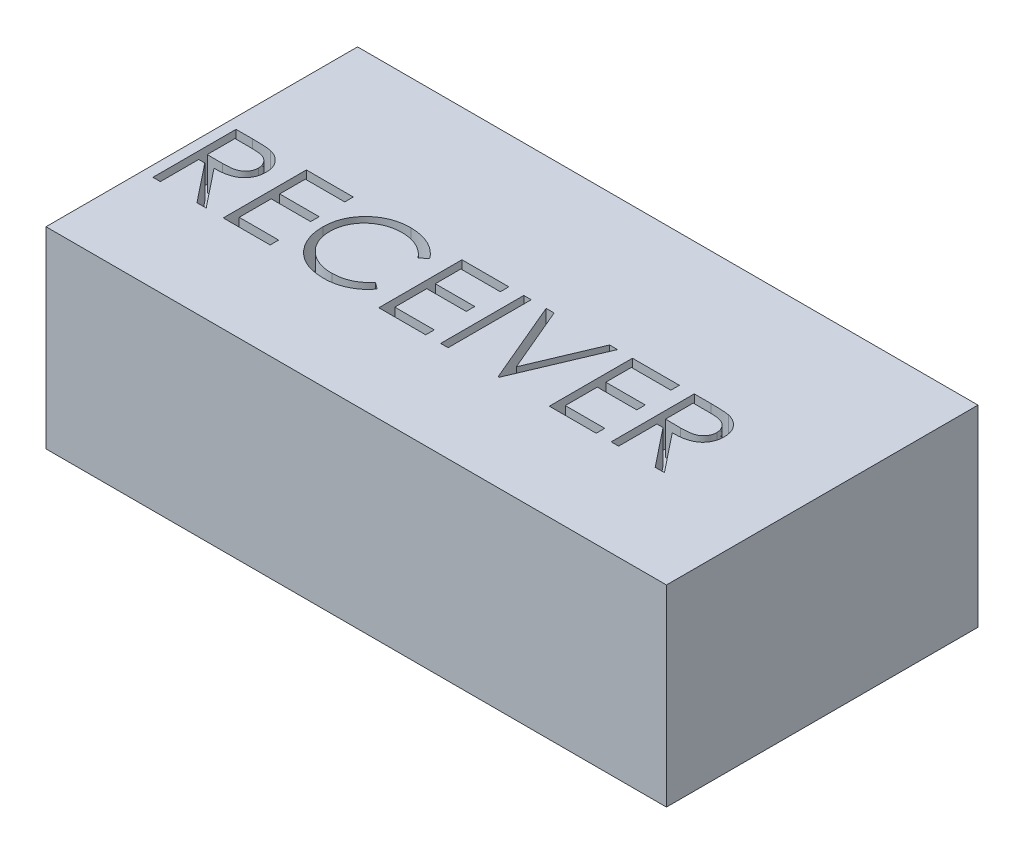
from build123d import *

# Parameters (mm, degrees)
SKETCH1_W           = 47.4
SKETCH1_H           = 23.8
BOSS_EXTRUDE1_DEPTH = 14.7
SKETCH2_W           = 0.569871795
SKETCH2_H           = 6.35
CUT_EXTRUDE1_DEPTH  = 2.54


with BuildPart() as part:
    # Sketch1 → Boss-Extrude1 (new body)
    with BuildSketch(Plane(origin=(0, 0, 0), x_dir=(1, 0, 0), z_dir=(0, 1, 0))):
        Rectangle(SKETCH1_W, SKETCH1_H)
    extrude(amount=BOSS_EXTRUDE1_DEPTH)

    # Sketch2 → Cut-Extrude1 (cut)
    # profile 1 of 8: a face of its own
    with BuildSketch(Plane(origin=(0, 14.7, 0), x_dir=(1, 0, 0), z_dir=(0, 1, 0))):
        with BuildLine():
            Line((-22.885897436, 1.803083105), (-21.615134215, 1.803083105))
            add(Edge.make_bspline(
                [(-21.615134215, 1.803083105), (-21.530332453, 1.802800827), (-21.367503677, 1.802258824), (-21.134235029, 1.799236654), (-20.922277296, 1.790574608), (-20.731741302, 1.783120464), (-20.562630542, 1.769527942), (-20.414426457, 1.756536482), (-20.287811635, 1.739529983), (-20.21116559, 1.723735859), (-20.17646234, 1.716584707)],
                knots=[0, 0, 0, 0, 1.410062039, 2.707475311, 3.878576406, 4.937260626, 5.877586885, 6.699081471, 7.410979367, 8, 8, 8, 8], degree=3))
            add(Edge.make_bspline(
                [(-20.17646234, 1.716584707), (-20.130004607, 1.705106147), (-20.038080212, 1.682393896), (-19.90572795, 1.63438862), (-19.779609105, 1.578835873), (-19.660247566, 1.513587409), (-19.548241202, 1.43815888), (-19.442435124, 1.353852429), (-19.342349212, 1.261129356), (-19.252031111, 1.157651858), (-19.166870261, 1.049091333), (-19.095045181, 0.931700232), (-19.033129996, 0.808942889), (-18.983834916, 0.679570859), (-18.944142021, 0.544838788), (-18.916154415, 0.403526256), (-18.899370118, 0.256277059), (-18.897661322, 0.155841996), (-18.896794872, 0.104916038)],
                knots=[0, 0, 0, 0, 1.027469482, 2.033020251, 3.019912614, 3.986113645, 4.951240523, 5.91722682, 6.890402269, 7.87763091, 8.8651537, 9.85103654, 10.82876324, 11.815024772, 12.821070561, 13.842952187, 14.906261191, 16, 16, 16, 16], degree=3))
            add(Edge.make_bspline(
                [(-18.896794872, 0.104916038), (-18.899460054, 0.020306634), (-18.904660515, -0.144788228), (-18.953147489, -0.384384399), (-19.032570603, -0.607885012), (-19.142014285, -0.815008656), (-19.281386762, -1.001717969), (-19.448890312, -1.165712081), (-19.644618378, -1.302944494), (-19.826825851, -1.398108868), (-19.987778757, -1.459056002), (-20.120282053, -1.501939111), (-20.264820712, -1.535071533), (-20.420009876, -1.564753487), (-20.586495365, -1.587162989), (-20.763878151, -1.603576096), (-20.95228474, -1.613834156), (-21.081714195, -1.615361794), (-21.148297276, -1.616147664)],
                knots=[0, 0, 0, 0, 1.260483769, 2.459530307, 3.627416485, 4.787058657, 5.939039949, 7.08810263, 8.267026773, 9.491475466, 10.141966685, 10.831826277, 11.566392101, 12.351337768, 13.187381173, 14.07005841, 15.007169909, 16, 16, 16, 16], degree=3))
            Line((-21.148297276, -1.616147664), (-18.815384615, -4.546916895))
            Line((-18.815384615, -4.546916895), (-19.520092147, -4.546916895))
            Line((-19.520092147, -4.546916895), (-21.853004808, -1.616147664))
            Line((-21.853004808, -1.616147664), (-22.316025641, -1.616147664))
            Line((-22.316025641, -1.616147664), (-22.316025641, -4.546916895))
            Line((-22.316025641, -4.546916895), (-22.885897436, -4.546916895))
            Line((-22.885897436, -4.546916895), (-22.885897436, 1.803083105))
        make_face()
        with BuildLine():
            Line((-22.316025641, 1.151801054), (-22.316025641, -0.964865613))
            Line((-22.316025641, -0.964865613), (-21.153385417, -0.97376986))
            add(Edge.make_bspline(
                [(-21.153385417, -0.97376986), (-21.099101917, -0.973793875), (-20.993885035, -0.973840423), (-20.841665258, -0.966594572), (-20.699933055, -0.958351694), (-20.569230548, -0.945743596), (-20.449499347, -0.929494723), (-20.340799297, -0.909169309), (-20.24295296, -0.885489138), (-20.12883704, -0.848837617), (-20.001407905, -0.790769555), (-19.862920828, -0.706286436), (-19.744988015, -0.60002532), (-19.645351322, -0.478516335), (-19.565287925, -0.344919141), (-19.508841769, -0.200835157), (-19.473023338, -0.049901829), (-19.468798691, 0.053835595), (-19.466666667, 0.106188073)],
                knots=[0, 0, 0, 0, 1.146690395, 2.22261258, 3.21895312, 4.145990853, 4.996080663, 5.770904154, 6.481378293, 7.121626537, 8.300444488, 9.431385265, 10.535395872, 11.636531494, 12.74115979, 13.810798291, 14.895190096, 16, 16, 16, 16], degree=3))
            add(Edge.make_bspline(
                [(-19.466666667, 0.106188073), (-19.468847658, 0.157253999), (-19.473169586, 0.258448033), (-19.508455209, 0.406595184), (-19.568125944, 0.546416651), (-19.648539147, 0.677343645), (-19.746509043, 0.796189766), (-19.861385646, 0.897875315), (-19.990027928, 0.981785058), (-20.110262817, 1.035405148), (-20.217730602, 1.068279739), (-20.3110387, 1.091413993), (-20.416469524, 1.110000387), (-20.534534998, 1.124892155), (-20.6647311, 1.137691839), (-20.807716138, 1.146312923), (-20.96254144, 1.151418077), (-21.069850872, 1.151670424), (-21.125400641, 1.151801054)],
                knots=[0, 0, 0, 0, 1.101028733, 2.181837193, 3.264309656, 4.369019818, 5.486613113, 6.575447106, 7.666700264, 8.788928104, 9.402425223, 10.0903467, 10.862060571, 11.710948788, 12.657782767, 13.684531032, 14.801375019, 16, 16, 16, 16], degree=3))
            Line((-21.125400641, 1.151801054), (-22.316025641, 1.151801054))
        make_face(mode=Mode.SUBTRACT)
    # profile 2 of 8: a face of its own
    with BuildSketch(Plane(origin=(0, 14.7, 0), x_dir=(1, 0, 0), z_dir=(0, 1, 0))):
        Polygon((-17.512820513, 1.803083105), (-13.930769231, 1.803083105), (-13.930769231, 1.151801054), (-16.942948718, 1.151801054), (-16.942948718, -0.8020451), (-13.930769231, -0.8020451), (-13.930769231, -1.453327152), (-16.942948718, -1.453327152), (-16.942948718, -3.895634844), (-13.930769231, -3.895634844), (-13.930769231, -4.546916895), (-17.512820513, -4.546916895), align=None)
    # profile 3 of 8: a face of its own
    with BuildSketch(Plane(origin=(0, 14.7, 0), x_dir=(1, 0, 0), z_dir=(0, 1, 0))):
        with BuildLine():
            Line((-6.929487179, 0.63789881), (-7.428125, 0.256288233))
            add(Edge.make_bspline(
                [(-7.428125, 0.256288233), (-7.463695683, 0.298680778), (-7.53435748, 0.382894325), (-7.648039176, 0.501148642), (-7.766515013, 0.611938473), (-7.889739705, 0.715791598), (-8.01993125, 0.809076301), (-8.153935842, 0.896653874), (-8.293995153, 0.975153913), (-8.4876733, 1.070336759), (-8.741034396, 1.169661926), (-9.059976461, 1.252943503), (-9.392918025, 1.305959064), (-9.620062242, 1.311700991), (-9.735596955, 1.314621566)],
                knots=[0, 0, 0, 0, 0.757959112, 1.505699292, 2.245454638, 2.979532153, 3.711538275, 4.438200793, 5.171680507, 5.909471876, 7.393775596, 8.890124382, 10.418191784, 12, 12, 12, 12], degree=3))
            add(Edge.make_bspline(
                [(-9.735596955, 1.314621566), (-9.799248084, 1.313888663), (-9.925959599, 1.312429658), (-10.114007544, 1.293181674), (-10.298544079, 1.266128479), (-10.479449168, 1.225986821), (-10.656492536, 1.175236498), (-10.830831608, 1.114593247), (-10.999942268, 1.039563751), (-11.166163928, 0.956635908), (-11.325420497, 0.862968973), (-11.476106084, 0.760800463), (-11.617671111, 0.651273674), (-11.750227565, 0.533978095), (-11.873910957, 0.409441967), (-11.987825078, 0.27633809), (-12.091575751, 0.135092004), (-12.187219496, -0.01243375), (-12.272876884, -0.165809458), (-12.344595379, -0.3256028), (-12.408104672, -0.489077387), (-12.458359013, -0.658080207), (-12.49813635, -0.831422082), (-12.525582254, -1.009568226), (-12.544611337, -1.192146473), (-12.546063087, -1.315897655), (-12.546794872, -1.378277071)],
                knots=[0, 0, 0, 0, 1.054917814, 2.100044995, 3.131103042, 4.146048494, 5.169673617, 6.183595914, 7.203665975, 8.234915748, 9.262203917, 10.264457458, 11.251630812, 12.227803204, 13.197192746, 14.159520551, 15.12972552, 16.100847026, 17.073214652, 18.039054194, 19.002613845, 19.979014051, 20.95965708, 21.949030935, 22.966165397, 24, 24, 24, 24], degree=3))
            add(Edge.make_bspline(
                [(-12.546794872, -1.378277071), (-12.544505572, -1.472132466), (-12.540010834, -1.656405084), (-12.500008857, -1.926317478), (-12.439221048, -2.1848907), (-12.348115644, -2.430508414), (-12.235776795, -2.666199292), (-12.093825972, -2.887975498), (-11.929421683, -3.099188408), (-11.740238093, -3.294846327), (-11.532673255, -3.473578372), (-11.309973473, -3.630968712), (-11.072693408, -3.762168571), (-10.82345295, -3.871344931), (-10.560334144, -3.955267851), (-10.283810145, -4.014348475), (-9.994482382, -4.05288786), (-9.796780757, -4.056577551), (-9.696163862, -4.058455357)],
                knots=[0, 0, 0, 0, 1.029171465, 2.020641659, 2.987623507, 3.938342917, 4.889210282, 5.84687017, 6.821220943, 7.821438502, 8.827599549, 9.822697543, 10.807740252, 11.797342354, 12.80366471, 13.83203677, 14.896651826, 16, 16, 16, 16], degree=3))
            add(Edge.make_bspline(
                [(-9.696163862, -4.058455357), (-9.585306126, -4.055391428), (-9.367111583, -4.049360882), (-9.047129592, -3.998271959), (-8.740813275, -3.915435451), (-8.448146154, -3.799506363), (-8.169953295, -3.648802198), (-7.905799355, -3.466107478), (-7.655461362, -3.24968436), (-7.50492775, -3.084433541), (-7.428125, -3.000122023)],
                knots=[0, 0, 0, 0, 1.028121516, 2.023589091, 2.998037872, 3.967518031, 4.937445131, 5.927275754, 6.942489185, 8, 8, 8, 8], degree=3))
            Line((-7.428125, -3.000122023), (-6.929487179, -3.377916494))
            add(Edge.make_bspline(
                [(-6.929487179, -3.377916494), (-6.96961575, -3.4296934), (-7.049680678, -3.532999203), (-7.179325938, -3.678635019), (-7.315900463, -3.815620912), (-7.46041868, -3.942852453), (-7.611218102, -4.062875555), (-7.77100644, -4.172280306), (-7.937683113, -4.272593768), (-8.110683382, -4.364445474), (-8.289823436, -4.445938193), (-8.474888626, -4.515704315), (-8.665081241, -4.575802329), (-8.860409978, -4.625245128), (-9.061279994, -4.663836952), (-9.266966425, -4.689635505), (-9.477913199, -4.707310121), (-9.620228349, -4.708921054), (-9.692347756, -4.709737408)],
                knots=[0, 0, 0, 0, 0.986787822, 1.968848986, 2.935600012, 3.899624008, 4.868462664, 5.837806735, 6.815139263, 7.798259679, 8.787526145, 9.778297419, 10.776456485, 11.791383307, 12.812564526, 13.85620153, 14.913611965, 16, 16, 16, 16], degree=3))
            add(Edge.make_bspline(
                [(-9.692347756, -4.709737408), (-9.760644124, -4.709262079), (-9.895691733, -4.708322174), (-10.095079468, -4.693096384), (-10.289189136, -4.67232329), (-10.477465957, -4.641044767), (-10.660937369, -4.604134321), (-10.837940144, -4.55465647), (-11.010216026, -4.499231553), (-11.177072872, -4.434089649), (-11.338652613, -4.360581718), (-11.4944341, -4.277502746), (-11.644345684, -4.185551363), (-11.789861233, -4.086754416), (-11.928831135, -3.977938454), (-12.062459674, -3.860614703), (-12.191496167, -3.735178597), (-12.271329609, -3.644727649), (-12.311468349, -3.599250629)],
                knots=[0, 0, 0, 0, 1.114604814, 2.203992996, 3.262667896, 4.300477797, 5.318619304, 6.316056647, 7.298880507, 8.271930387, 9.238335007, 10.195173496, 11.151986948, 12.108099108, 13.064862484, 14.031167946, 15.010108607, 16, 16, 16, 16], degree=3))
            add(Edge.make_bspline(
                [(-12.311468349, -3.599250629), (-12.375758731, -3.520254472), (-12.503563325, -3.363215869), (-12.667077065, -3.108697017), (-12.807044772, -2.842961838), (-12.920212514, -2.564614253), (-13.008682044, -2.274278851), (-13.069970784, -1.971809274), (-13.109797266, -1.657488008), (-13.114351648, -1.443698406), (-13.116666667, -1.335027873)],
                knots=[0, 0, 0, 0, 0.994628077, 1.977248131, 2.950237994, 3.925870899, 4.908910175, 5.911660606, 6.938484602, 8, 8, 8, 8], degree=3))
            add(Edge.make_bspline(
                [(-13.116666667, -1.335027873), (-13.113845101, -1.220808693), (-13.108293847, -0.996089587), (-13.061130047, -0.6662997), (-12.985258802, -0.350339305), (-12.877495876, -0.048798225), (-12.740870453, 0.239909569), (-12.572093596, 0.513578612), (-12.373126067, 0.773959091), (-12.145528337, 1.01710014), (-11.895941886, 1.239421537), (-11.628663466, 1.435012792), (-11.34421622, 1.597786), (-11.045733832, 1.733850466), (-10.730981238, 1.838433992), (-10.400629983, 1.911646202), (-10.055300809, 1.957215827), (-9.819693265, 1.962976562), (-9.699979968, 1.965903618)],
                knots=[0, 0, 0, 0, 1.032925535, 2.032216505, 3.007276963, 3.968222605, 4.92396291, 5.891752235, 6.871517503, 7.883894988, 8.900124299, 9.891468569, 10.874487609, 11.85992873, 12.854644235, 13.869047385, 14.917252991, 16, 16, 16, 16], degree=3))
            add(Edge.make_bspline(
                [(-9.699979968, 1.965903618), (-9.627019426, 1.965028881), (-9.482601381, 1.963297429), (-9.268964426, 1.946413428), (-9.06097049, 1.918267314), (-8.85847628, 1.87995673), (-8.660496676, 1.832409161), (-8.46854481, 1.770468905), (-8.281494336, 1.699645484), (-8.100524945, 1.618077982), (-7.926504918, 1.526516894), (-7.759488455, 1.42597712), (-7.600802211, 1.316583301), (-7.449329586, 1.199265826), (-7.30760446, 1.071542725), (-7.171602921, 0.936927087), (-7.045943536, 0.791541435), (-6.968377025, 0.689206769), (-6.929487179, 0.63789881)],
                knots=[0, 0, 0, 0, 1.096760587, 2.17092713, 3.219439832, 4.250915756, 5.268269357, 6.278326846, 7.281116186, 8.274029601, 9.260640565, 10.235837813, 11.203064059, 12.156899882, 13.114053108, 14.069676657, 15.032185724, 16, 16, 16, 16], degree=3))
        make_face()
    # profile 4 of 8: a face of its own
    with BuildSketch(Plane(origin=(0, 14.7, 0), x_dir=(1, 0, 0), z_dir=(0, 1, 0))):
        Polygon((-5.626923077, 1.803083105), (-2.044871795, 1.803083105), (-2.044871795, 1.151801054), (-5.057051282, 1.151801054), (-5.057051282, -0.8020451), (-2.044871795, -0.8020451), (-2.044871795, -1.453327152), (-5.057051282, -1.453327152), (-5.057051282, -3.895634844), (-2.044871795, -3.895634844), (-2.044871795, -4.546916895), (-5.626923077, -4.546916895), align=None)
    # profile 5 of 8: a face of its own
    with BuildSketch(Plane(origin=(0, 14.7, 0), x_dir=(1, 0, 0), z_dir=(0, 1, 0))):
        with Locations((-0.620192307, -1.371916895)):
            Rectangle(SKETCH2_W, SKETCH2_H)
    # profile 6 of 8: a face of its own
    with BuildSketch(Plane(origin=(0, 14.7, 0), x_dir=(1, 0, 0), z_dir=(0, 1, 0))):
        Polygon((0.804487179, 1.803083105), (1.415064103, 1.803083105), (3.531730769, -3.201103594), (5.648397436, 1.803083105), (6.258974359, 1.803083105), (3.572435897, -4.546916895), (3.491025641, -4.546916895), align=None)
    # profile 7 of 8: a face of its own
    with BuildSketch(Plane(origin=(0, 14.7, 0), x_dir=(1, 0, 0), z_dir=(0, 1, 0))):
        Polygon((7.398717949, 1.803083105), (10.980769231, 1.803083105), (10.980769231, 1.151801054), (7.968589744, 1.151801054), (7.968589744, -0.8020451), (10.980769231, -0.8020451), (10.980769231, -1.453327152), (7.968589744, -1.453327152), (7.968589744, -3.895634844), (10.980769231, -3.895634844), (10.980769231, -4.546916895), (7.398717949, -4.546916895), align=None)
    # profile 8 of 8: a face of its own
    with BuildSketch(Plane(origin=(0, 14.7, 0), x_dir=(1, 0, 0), z_dir=(0, 1, 0))):
        with BuildLine():
            Line((12.120512821, 1.803083105), (13.391276042, 1.803083105))
            add(Edge.make_bspline(
                [(13.391276042, 1.803083105), (13.476077803, 1.802800827), (13.63890658, 1.802258824), (13.872175227, 1.799236654), (14.08413296, 1.790574608), (14.274668955, 1.783120464), (14.443779714, 1.769527942), (14.591983799, 1.756536482), (14.718598622, 1.739529983), (14.795244666, 1.723735859), (14.829947917, 1.716584707)],
                knots=[0, 0, 0, 0, 1.410062039, 2.707475311, 3.878576406, 4.937260626, 5.877586885, 6.699081471, 7.410979367, 8, 8, 8, 8], degree=3))
            add(Edge.make_bspline(
                [(14.829947917, 1.716584707), (14.876405649, 1.705106147), (14.968330044, 1.682393896), (15.100682307, 1.63438862), (15.226801152, 1.578835873), (15.34616269, 1.513587409), (15.458169054, 1.43815888), (15.563975132, 1.353852429), (15.664061044, 1.261129356), (15.754379145, 1.157651858), (15.839539996, 1.049091333), (15.911365075, 0.931700232), (15.97328026, 0.808942889), (16.022575341, 0.679570859), (16.062268236, 0.544838788), (16.090255841, 0.403526256), (16.107040139, 0.256277059), (16.108748934, 0.155841996), (16.109615385, 0.104916038)],
                knots=[0, 0, 0, 0, 1.027469482, 2.033020251, 3.019912614, 3.986113645, 4.951240523, 5.91722682, 6.890402269, 7.87763091, 8.8651537, 9.85103654, 10.82876324, 11.815024772, 12.821070561, 13.842952187, 14.906261191, 16, 16, 16, 16], degree=3))
            add(Edge.make_bspline(
                [(16.109615385, 0.104916038), (16.106950202, 0.020306634), (16.101749741, -0.144788228), (16.053262768, -0.384384399), (15.973839653, -0.607885012), (15.864395972, -0.815008656), (15.725023494, -1.001717969), (15.557519945, -1.165712081), (15.361791878, -1.302944494), (15.179584405, -1.398108868), (15.0186315, -1.459056002), (14.886128204, -1.501939111), (14.741589545, -1.535071533), (14.58640038, -1.564753487), (14.419914891, -1.587162989), (14.242532105, -1.603576096), (14.054125516, -1.613834156), (13.924696062, -1.615361794), (13.858112981, -1.616147664)],
                knots=[0, 0, 0, 0, 1.260483769, 2.459530307, 3.627416485, 4.787058657, 5.939039949, 7.08810263, 8.267026773, 9.491475466, 10.141966685, 10.831826277, 11.566392101, 12.351337768, 13.187381173, 14.07005841, 15.007169909, 16, 16, 16, 16], degree=3))
            Line((13.858112981, -1.616147664), (16.191025641, -4.546916895))
            Line((16.191025641, -4.546916895), (15.486318109, -4.546916895))
            Line((15.486318109, -4.546916895), (13.153405449, -1.616147664))
            Line((13.153405449, -1.616147664), (12.690384615, -1.616147664))
            Line((12.690384615, -1.616147664), (12.690384615, -4.546916895))
            Line((12.690384615, -4.546916895), (12.120512821, -4.546916895))
            Line((12.120512821, -4.546916895), (12.120512821, 1.803083105))
        make_face()
        with BuildLine():
            Line((12.690384615, 1.151801054), (12.690384615, -0.964865613))
            Line((12.690384615, -0.964865613), (13.85302484, -0.97376986))
            add(Edge.make_bspline(
                [(13.85302484, -0.97376986), (13.907308339, -0.973793875), (14.012525221, -0.973840423), (14.164744999, -0.966594572), (14.306477201, -0.958351694), (14.437179709, -0.945743596), (14.55691091, -0.929494723), (14.66561096, -0.909169309), (14.763457297, -0.885489138), (14.877573216, -0.848837617), (15.005002352, -0.790769555), (15.143489429, -0.706286436), (15.261422242, -0.60002532), (15.361058935, -0.478516335), (15.441122332, -0.344919141), (15.497568488, -0.200835157), (15.533386919, -0.049901829), (15.537611565, 0.053835595), (15.53974359, 0.106188073)],
                knots=[0, 0, 0, 0, 1.146690395, 2.22261258, 3.21895312, 4.145990853, 4.996080663, 5.770904154, 6.481378293, 7.121626537, 8.300444488, 9.431385265, 10.535395872, 11.636531494, 12.74115979, 13.810798291, 14.895190096, 16, 16, 16, 16], degree=3))
            add(Edge.make_bspline(
                [(15.53974359, 0.106188073), (15.537562599, 0.157253999), (15.53324067, 0.258448033), (15.497955047, 0.406595184), (15.438284312, 0.546416651), (15.357871109, 0.677343645), (15.259901214, 0.796189766), (15.145024611, 0.897875315), (15.016382328, 0.981785058), (14.89614744, 1.035405148), (14.788679654, 1.068279739), (14.695371557, 1.091413993), (14.589940733, 1.110000387), (14.471875258, 1.124892155), (14.341679156, 1.137691839), (14.198694118, 1.146312923), (14.043868817, 1.151418077), (13.936559384, 1.151670424), (13.881009615, 1.151801054)],
                knots=[0, 0, 0, 0, 1.101028733, 2.181837193, 3.264309656, 4.369019818, 5.486613113, 6.575447106, 7.666700264, 8.788928104, 9.402425223, 10.0903467, 10.862060571, 11.710948788, 12.657782767, 13.684531032, 14.801375019, 16, 16, 16, 16], degree=3))
            Line((13.881009615, 1.151801054), (12.690384615, 1.151801054))
        make_face(mode=Mode.SUBTRACT)
    extrude(amount=-CUT_EXTRUDE1_DEPTH, mode=Mode.SUBTRACT)


solid = part.part
